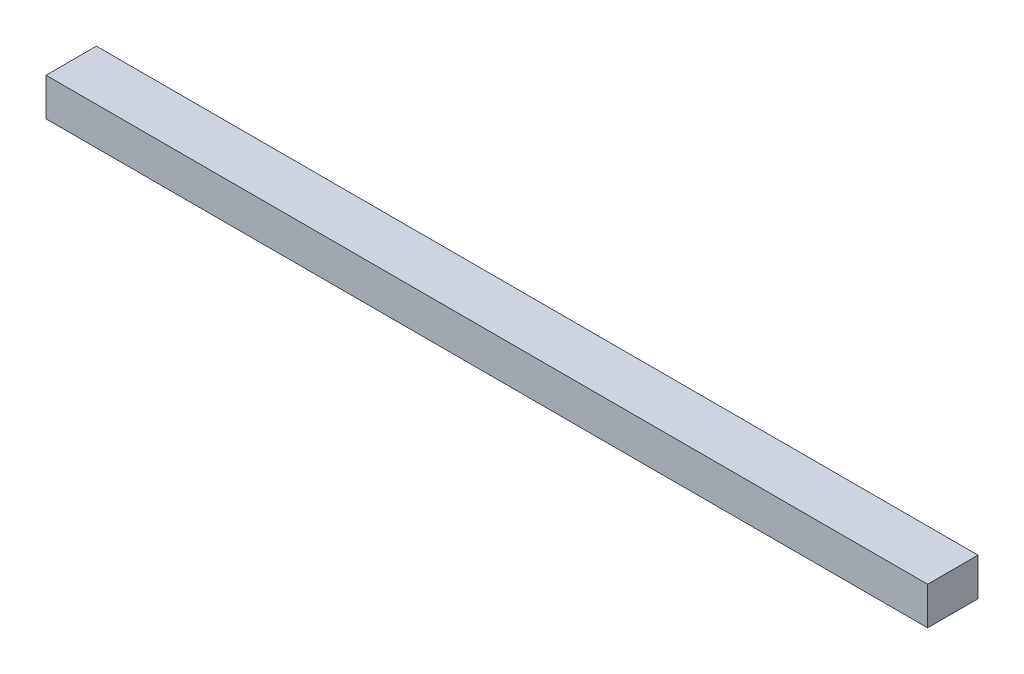
from build123d import *

# Parameters (mm, degrees)
SKETCH1_W           = 140
SKETCH1_H           = 8
BOSS_EXTRUDE1_DEPTH = 6


with BuildPart() as part:
    # Sketch1 → Boss-Extrude1 (new body)
    with BuildSketch(Plane(origin=(0, 0, 0), x_dir=(1, 0, 0), z_dir=(0, 1, 0))):
        with Locations((70, 4)):
            Rectangle(SKETCH1_W, SKETCH1_H)
    extrude(amount=BOSS_EXTRUDE1_DEPTH)


solid = part.part
